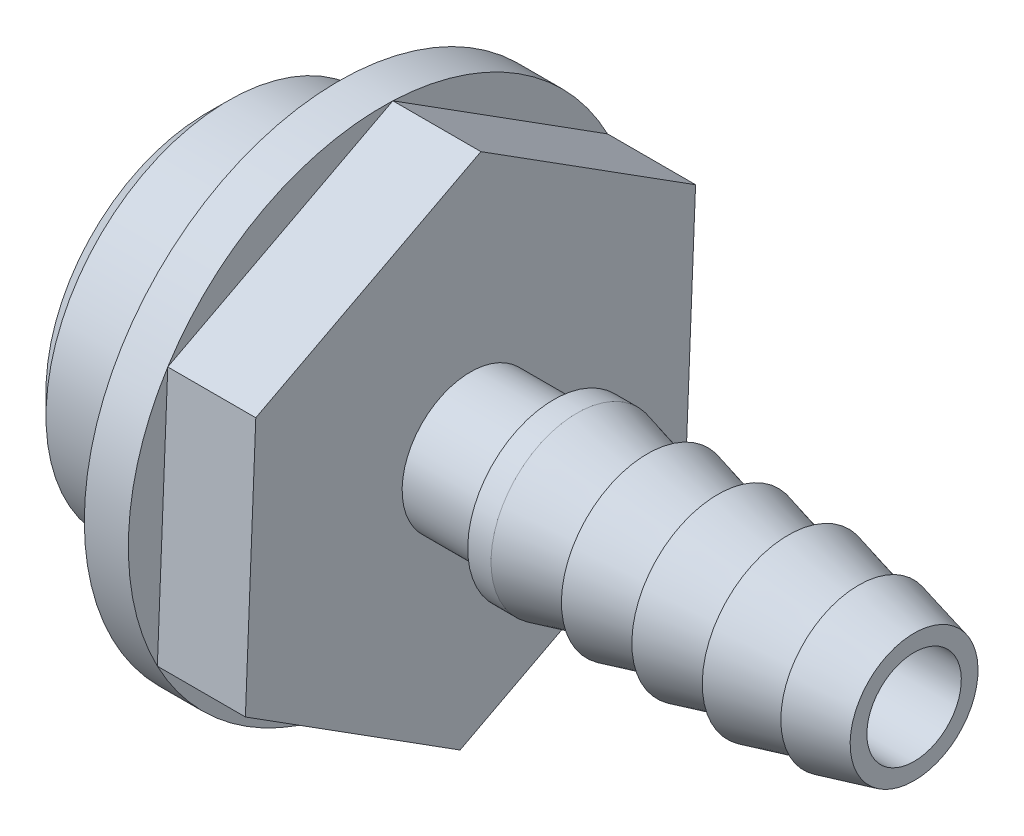
from build123d import *

# Parameters (mm, degrees)
CHAMFER1_SIZE    = 0.79375
CHAMFER1_SIZE_2  = 3.175
EXTRUSION1_DEPTH = 3.175
ESQUISSE3_R      = 9.165435523
EXTRUSION2_DEPTH = 1.5875
ESQUISSE4_R      = 6.5786
THREAD1_DEPTH    = 4.7625
CHAMFER2_SIZE    = 0.79375
CHAMFER4_SIZE    = 1


with BuildPart() as part:
    # Esquisse1 → Revolution1 (revolve)
    with BuildSketch(Plane.XY, mode=Mode.PRIVATE) as revolution1_sk:
        Polygon((0, 1.703), (16, 1.703), (16, 3.1), (14, 3.1), (14, 2.465), (11.46, 3.1), (11.46, 2.465), (8.92, 3.1), (8.92, 2.465), (6.38, 3.1), (6.38, 2.465), (3.84, 3.1), (3, 3.1), (3, 2.465), (0, 2.465), align=None)
    revolve(revolution1_sk.sketch.rotate(Axis((0, 0, 0), (1, 0, 0)), 180), axis=Axis((0, 0, 0), (1, 0, 0)))

    # Chamfer1
    # the kernel refuses this chamfer: 3.175, 0.79375 mm, written as the material it takes off along each edge
    with BuildSketch(Plane(origin=(16, 0, 0), x_dir=(0, -1, 0), z_dir=(0, 0, 1))) as chamfer1_piece_1:
        Polygon((3.1 - CHAMFER1_SIZE, 0), (3.1, -CHAMFER1_SIZE_2), (3.1, 0), align=None)
    revolve(axis=Axis((16, 0, 0), (1, 0, 0)), mode=Mode.SUBTRACT)

    # Esquisse2 → Extrusion1 (add)
    with BuildSketch(Plane.ZY):
        Polygon((0.375877143, -9.157724865), (-7.742883803, -4.904381587), (-8.118760946, 4.253343278), (-0.375877143, 9.157724865), (7.742883803, 4.904381587), (8.118760946, -4.253343278), align=None)
    extrude(amount=EXTRUSION1_DEPTH)

    # Esquisse3 → Extrusion2 (add)
    with BuildSketch(Plane.ZY.offset(3.175)):
        with Locations(Location((0, 0, 0), (0, 0, 152.350375514))):
            Circle(ESQUISSE3_R)
    extrude(amount=EXTRUSION2_DEPTH)

    # Esquisse4 → Thread1 (add)
    with BuildSketch(Plane.ZY.offset(4.7625)):
        with Locations(Location((0, 0, 0), (0, 0, 180))):
            Circle(ESQUISSE4_R)
    extrude(amount=THREAD1_DEPTH)

    # Chamfer2
    chamfer2_edges = [part.edges().sort_by_distance(p)[0] for p in [
        (-9.525, 0, 6.5786),
    ]]
    chamfer(chamfer2_edges, length=CHAMFER2_SIZE)

    # Sketch1 → Cut-Revolve1 (revolve, cut)
    with BuildSketch(Plane(origin=(0, 0, 0), x_dir=(1, 0, 0), z_dir=(0, 1, 0)), mode=Mode.PRIVATE) as cut_revolve1_sk:
        Polygon((0, -1.703), (-2, -1.703), (-2, -5), (-9.525, -5), (-9.525, 0), (0, 0), align=None)
    revolve(cut_revolve1_sk.sketch.rotate(Axis((-9.525, 0, 0), (1, 0, 0)), 90), axis=Axis((-9.525, 0, 0), (1, 0, 0)), mode=Mode.SUBTRACT)

    # Chamfer4
    chamfer4_edges = [part.edges().sort_by_distance(p)[0] for p in [
        (-2, 1.703, 0),
    ]]
    chamfer(chamfer4_edges, length=CHAMFER4_SIZE)


solid = part.part
